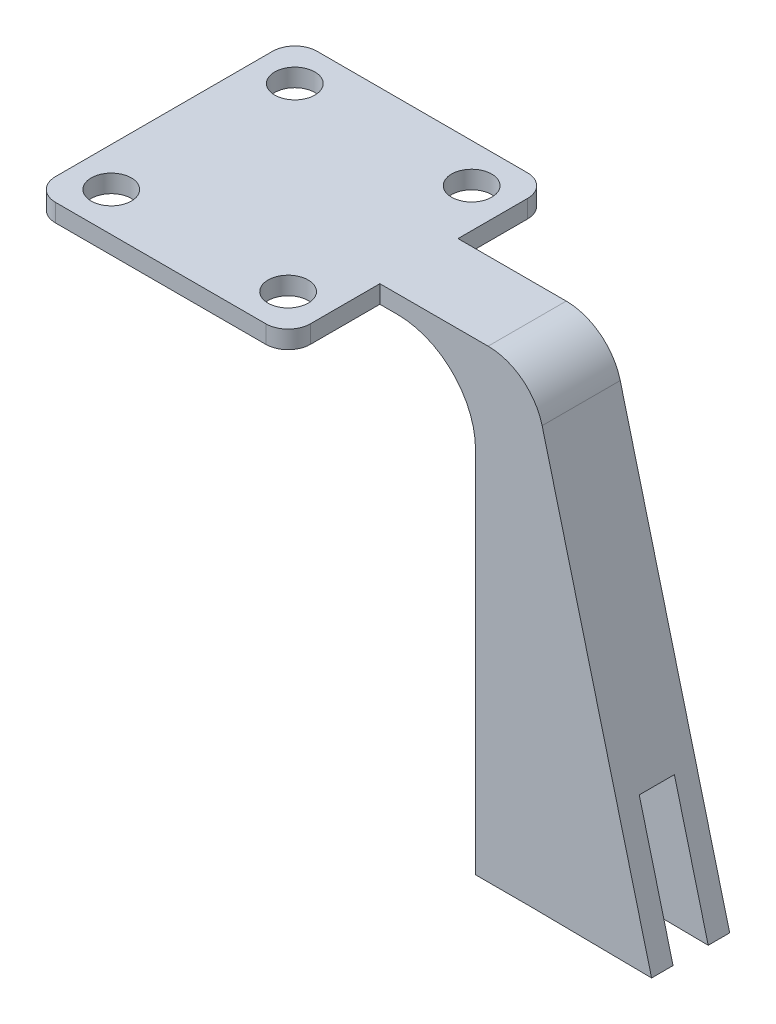
from build123d import *

# Parameters (mm, degrees)
SKETCH1_R           = 1.8
BOSS_EXTRUDE1_DEPTH = 1.6
SKETCH2_R           = 1.8
CUT_EXTRUDE1_DEPTH  = 1.6
SKETCH3_W           = 25
SKETCH3_H           = 7
BOSS_EXTRUDE2_DEPTH = 1.6
SKETCH4_W           = 5
SKETCH4_H           = 7
BOSS_EXTRUDE3_DEPTH = 40
FILLET1_R           = 7
BOSS_EXTRUDE4_DEPTH = 7
FILLET2_R           = 5
SKETCH10_W          = 20.021221805
SKETCH10_H          = 3.15
CUT_EXTRUDE4_DEPTH  = 11.7
SKETCH11_W          = 5
SKETCH11_H          = 3.15
CUT_EXTRUDE5_DEPTH  = 11.7


with BuildPart() as part:
    # Sketch1 → Boss-Extrude1 (new body)
    with BuildSketch(Plane(origin=(0, 0, 0), x_dir=(1, 0, 0), z_dir=(0, 1, 0))):
        with BuildLine():
            Line((-9.425, -11.725), (9.425, -11.725))
            ThreePointArc((9.425, -11.725), (10.839213562, -11.139213562), (11.425, -9.725))
            Line((11.425, -9.725), (11.425, 9.725))
            ThreePointArc((11.425, 9.725), (10.839213562, 11.139213562), (9.425, 11.725))
            Line((9.425, 11.725), (-9.425, 11.725))
            ThreePointArc((-9.425, 11.725), (-10.839213562, 11.139213562), (-11.425, 9.725))
            Line((-11.425, 9.725), (-11.425, -9.725))
            ThreePointArc((-11.425, -9.725), (-10.839213562, -11.139213562), (-9.425, -11.725))
        make_face()
        with Locations((-7.925, 8.225)):
            Circle(SKETCH1_R, mode=Mode.SUBTRACT)
    extrude(amount=BOSS_EXTRUDE1_DEPTH)

    # Sketch2 → Cut-Extrude1 (cut)
    with BuildSketch(Plane(origin=(0, 1.6, 0), x_dir=(1, 0, 0), z_dir=(0, 1, 0))):
        with Locations((7.925, 8.225)):
            Circle(SKETCH2_R)
        with Locations((-7.925, -8.225)):
            Circle(SKETCH2_R)
        with Locations((7.925, -8.225)):
            Circle(SKETCH2_R)
    extrude(amount=-CUT_EXTRUDE1_DEPTH, mode=Mode.SUBTRACT)

    # Sketch3 → Boss-Extrude2 (add)
    with BuildSketch(Plane(origin=(0, 1.6, 0), x_dir=(1, 0, 0), z_dir=(0, 1, 0))):
        with Locations((12.5, 0)):
            Rectangle(SKETCH3_W, SKETCH3_H)
    extrude(amount=-BOSS_EXTRUDE2_DEPTH)

    # Sketch4 → Boss-Extrude3 (add)
    with BuildSketch(Plane.XZ):
        with Locations((22.5, 0)):
            Rectangle(SKETCH4_W, SKETCH4_H)
    extrude(amount=BOSS_EXTRUDE3_DEPTH)

    # Fillet1
    fillet1_edges = [part.edges().sort_by_distance(p)[0] for p in [
        (20, 0, 0),
    ]]
    fillet(fillet1_edges, radius=FILLET1_R)

    # Sketch7 → Boss-Extrude4 (add)
    with BuildSketch(Plane.XY.offset(3.5)):
        Polygon((25, 1.6), (35.779116369, -40.119915044), (25, -40), align=None)
    extrude(amount=-BOSS_EXTRUDE4_DEPTH)

    # Fillet2
    fillet2_edges = [part.edges().sort_by_distance(p)[0] for p in [
        (25, 1.6, 0),
    ]]
    fillet(fillet2_edges, radius=FILLET2_R)

    # Sketch10 → Cut-Extrude4 (cut)
    with BuildSketch(Plane(origin=(-0.441841569, -39.71696571, 0), x_dir=(0.9999381256405767, -0.011124068069294642, 0), z_dir=(-0.011124068069294644, -0.9999381256405768, 0))):
        with Locations((29.654842671, 0)):
            Rectangle(SKETCH10_W, SKETCH10_H)
    extrude(amount=-CUT_EXTRUDE4_DEPTH, mode=Mode.SUBTRACT)

    # Sketch11 → Cut-Extrude5 (cut)
    with BuildSketch(Plane.XZ.offset(40)):
        with Locations((22.5, 0)):
            Rectangle(SKETCH11_W, SKETCH11_H)
    extrude(amount=-CUT_EXTRUDE5_DEPTH, mode=Mode.SUBTRACT)


solid = part.part
